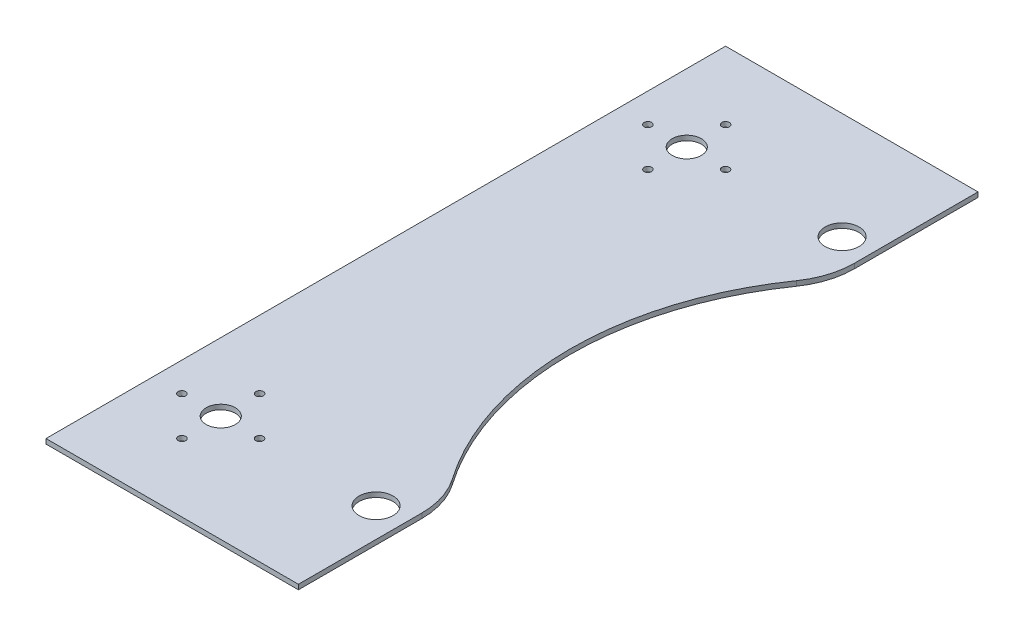
from build123d import *

# Parameters (mm, degrees)
SKETCH1_W                    = 165.1
SKETCH1_H                    = 444.5
BOSS_EXTRUDE1_DEPTH          = 3.175
CUT_EXTRUDE2_DEPTH           = 238.106823236
F_10_0_1935_DIAMETER_HOLE1_D = 4.9149
SKETCH7_R                    = 11.1125
CUT_EXTRUDE3_DEPTH           = 238.106823236
CUT_EXTRUDE4_DEPTH           = 238.106823236


with BuildPart() as part:
    # Sketch1 → Boss-Extrude1 (new body)
    with BuildSketch(Plane(origin=(0, 0, 0), x_dir=(1, 0, 0), z_dir=(0, 1, 0))):
        Rectangle(SKETCH1_W, SKETCH1_H)
    extrude(amount=BOSS_EXTRUDE1_DEPTH)

    # Sketch3 → Cut-Extrude2 (cut, through all)
    with BuildSketch(Plane(origin=(0, 3.175, 0), x_dir=(1, 0, 0), z_dir=(0, 1, 0))):
        with BuildLine():
            ThreePointArc((-28.575, -152.4), (-38.1, -142.875), (-47.625, -152.4))
            ThreePointArc((-47.625, -152.4), (-38.1, -161.925), (-28.575, -152.4))
        make_face()
        with BuildLine():
            ThreePointArc((-28.575, 152.4), (-38.1, 161.925), (-47.625, 152.4))
            ThreePointArc((-47.625, 152.4), (-38.1, 142.875), (-28.575, 152.4))
        make_face()
    extrude(amount=-CUT_EXTRUDE2_DEPTH, mode=Mode.SUBTRACT)

    # #10 (0.1935) Diameter Hole1 (through all)
    with Locations(Plane(origin=(0, 3.175, 0), x_dir=(1, 0, 0), z_dir=(0, 1, 0))):
        with Locations((-38.1, -177.8), (-63.5, -152.4), (-38.1, -127), (-12.7, -152.4), (-38.1, 177.8), (-63.5, 152.4), (-38.1, 127), (-12.7, 152.4)):
            Hole(F_10_0_1935_DIAMETER_HOLE1_D / 2)

    # Sketch7 → Cut-Extrude3 (cut, through all)
    with BuildSketch(Plane(origin=(0, 3.175, 0), x_dir=(1, 0, 0), z_dir=(0, 1, 0))):
        with Locations((63.5, -152.4)):
            Circle(SKETCH7_R)
        with Locations((63.5, 152.4)):
            Circle(SKETCH7_R)
    extrude(amount=-CUT_EXTRUDE3_DEPTH, mode=Mode.SUBTRACT)

    # Sketch8 → Cut-Extrude4 (cut, through all)
    with BuildSketch(Plane(origin=(0, 3.175, 0), x_dir=(1, 0, 0), z_dir=(0, 1, 0))):
        with BuildLine():
            Line((82.55, 222.25), (82.55, 141.563704741))
            ThreePointArc((82.55, 141.563704741), (80.216938242, 126.345429627), (73.432051282, 112.524996076))
            ThreePointArc((73.432051282, 112.524996076), (38.1, 0), (73.432051282, -112.524996076))
            ThreePointArc((73.432051282, -112.524996076), (80.216938242, -126.345429627), (82.55, -141.563704741))
            Line((82.55, -141.563704741), (82.55, -222.25))
            Line((82.55, -222.25), (95.25, -222.25))
            Line((95.25, -222.25), (95.25, 222.25))
            Line((95.25, 222.25), (82.55, 222.25))
        make_face()
    extrude(amount=-CUT_EXTRUDE4_DEPTH, mode=Mode.SUBTRACT)


solid = part.part
